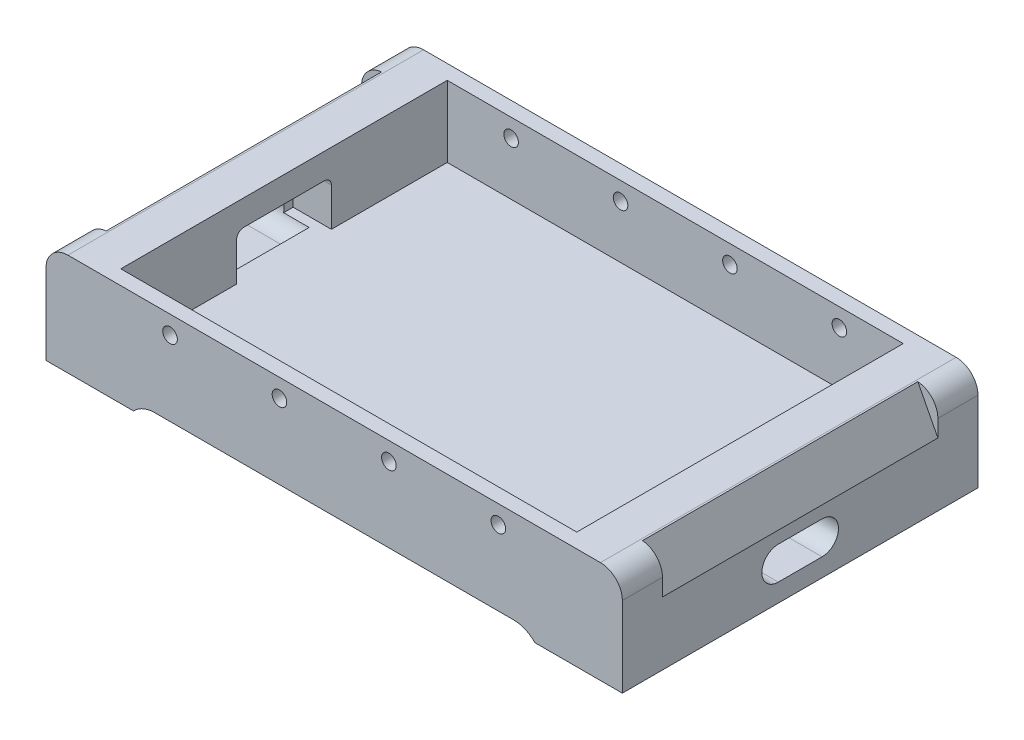
from build123d import *

# Parameters (mm, degrees)
SKETCH1_W            = 501.65
SKETCH1_H            = 88.9
BOSS_EXTRUDE1_DEPTH  = 309.5625
SKETCH2_W            = 349.25
SKETCH2_H            = 7.9375
CUT_EXTRUDE1_DEPTH   = 401.896401245
FILLET1_R            = 25.4
CUT_EXTRUDE2_DEPTH   = 119.85625
FILLET2_R            = 19.05
CUT_EXTRUDE4_DEPTH   = 41.275
SKETCH4_W            = 396.875
SKETCH4_H            = 284.1625
CUT_EXTRUDE3_DEPTH   = 61.9125
SKETCH6_W            = 82.55
SKETCH6_H            = 39.6875
CUT_EXTRUDE5_DEPTH   = 33.3375
FILLET3_R            = 6.35
SKETCH7_R            = 6.35
CUT_EXTRUDE6_DEPTH   = 401.896401245
FILLET3_OF_MIRROR5_R = 6.35


# Some blends are built 0.0001 mm under size
with BuildPart() as part:
    # Sketch1 → Boss-Extrude1 (new body)
    with BuildSketch(Plane.XY):
        Rectangle(SKETCH1_W, SKETCH1_H)
    extrude(amount=BOSS_EXTRUDE1_DEPTH)

    # Sketch2 → Cut-Extrude1 (cut, through all)
    with BuildSketch(Plane.XY.offset(309.5625)):
        with Locations((0, -40.48125)):
            Rectangle(SKETCH2_W, SKETCH2_H)
    extrude(amount=-CUT_EXTRUDE1_DEPTH, mode=Mode.SUBTRACT)

    # Fillet1
    # the kernel refuses this fillet: 25.4 mm, written as the material it adds along each edge
    with BuildSketch(Plane(origin=(174.625, -36.5125, 309.5625), x_dir=(0, -1, 0), z_dir=(0, 0, -1))) as fillet1_piece_1:
        with BuildLine():
            CenterArc((25.4, 18.445083186), FILLET1_R, 180, 46.567463442)
            Line((0, 18.445083186), (-0.508, 18.445083186))
            Line((-0.508, 18.445083186), (-0.508, 0))
            Line((-0.508, 0), (0, -0.508))
            ThreePointArc((0, -0.508), (3.96875, -0.508), (7.58825, -0.368901664))
            Line((7.58825, -0.368901664), (7.9375, 0))
        make_face()
    extrude(amount=309.5625)
    with BuildSketch(Plane(origin=(-174.625, -36.5125, 309.5625), x_dir=(0, -1, 0), z_dir=(0, 0, -1))) as fillet1_piece_2:
        with BuildLine():
            CenterArc((25.4, -18.445083186), FILLET1_R, 133.432536558, 46.567463442)
            Line((0, -18.445083186), (-0.508, -18.445083186))
            Line((-0.508, -18.445083186), (-0.508, 0))
            Line((-0.508, 0), (0, 0.508))
            ThreePointArc((0, 0.508), (3.96875, 0.508), (7.58825, 0.368901664))
            Line((7.58825, 0.368901664), (7.9375, 0))
        make_face()
    extrude(amount=309.5625)

    # Sketch3 → Cut-Extrude2 (cut, symmetric)
    with BuildSketch(Plane.XY.offset(154.78125)):
        Polygon((-250.825, 44.45), (-233.3625, 44.45), (-250.825, 10.5874677), align=None)
    cut_extrude2 = extrude(amount=CUT_EXTRUDE2_DEPTH, both=True, mode=Mode.SUBTRACT)

    # Fillet2
    fillet2_edges = [part.edges().sort_by_distance(p)[0] for p in [
        (250.825, 44.45, 154.78125),
    ]]
    fillet(fillet2_edges, radius=FILLET2_R)
    # the kernel refuses this fillet: 19.05 mm, written as the material it takes off along each edge
    with BuildSketch(Plane(origin=(-250.825, 44.45, -47.625), x_dir=(1, 0, 0), z_dir=(0, 0, 1))) as fillet2_2_piece_1:
        with BuildLine():
            CenterArc((FILLET2_R, -FILLET2_R), FILLET2_R, 90, 90)
            Line((0, -FILLET2_R), (-FILLET2_R * 0.02, -FILLET2_R))
            Line((-FILLET2_R * 0.02, -FILLET2_R), (-FILLET2_R * 0.02, FILLET2_R * 0.02))
            Line((-FILLET2_R * 0.02, FILLET2_R * 0.02), (FILLET2_R, FILLET2_R * 0.02))
            Line((FILLET2_R, FILLET2_R * 0.02), (FILLET2_R, 0))
        make_face()
    extrude(amount=130.175, mode=Mode.SUBTRACT)
    fillet2_3_edges = [part.edges().sort_by_distance(p)[0] for p in [
        (-250.825, 44.45, 292.1),
    ]]
    fillet(fillet2_3_edges, radius=FILLET2_R - 0.0001)  # a hair under: the kernel refuses the full size

    # Sketch5 → Cut-Extrude4 (cut)
    with BuildSketch(Plane.ZY.offset(250.825)):
        with BuildLine():
            Line((135.73125, 0), (173.83125, 0))
            ThreePointArc((173.83125, 0), (188.11875, -14.2875), (173.83125, -28.575))
            Line((173.83125, -28.575), (135.73125, -28.575))
            ThreePointArc((135.73125, -28.575), (121.44375, -14.2875), (135.73125, 0))
        make_face()
    cut_extrude4 = extrude(amount=-CUT_EXTRUDE4_DEPTH, mode=Mode.SUBTRACT)

    # Mirror4: Cut-Extrude2, Cut-Extrude4 across plane
    add(cut_extrude2.mirror(Plane.ZY), mode=Mode.SUBTRACT)
    add(cut_extrude4.mirror(Plane.ZY), mode=Mode.SUBTRACT)

    # Sketch4 → Cut-Extrude3 (cut)
    with BuildSketch(Plane(origin=(0, 44.45, 0), x_dir=(1, 0, 0), z_dir=(0, 1, 0))):
        with Locations((0, -154.78125)):
            Rectangle(SKETCH4_W, SKETCH4_H)
    extrude(amount=-CUT_EXTRUDE3_DEPTH, mode=Mode.SUBTRACT)

    # Sketch6 → Cut-Extrude5 (cut)
    with BuildSketch(Plane.ZY.offset(198.4375)):
        with Locations((154.78125, 2.38125)):
            Rectangle(SKETCH6_W, SKETCH6_H)
    cut_extrude5 = extrude(amount=CUT_EXTRUDE5_DEPTH, mode=Mode.SUBTRACT)

    # Fillet3
    fillet3_edges = [part.edges().sort_by_distance(p)[0] for p in [
        (-215.10625, 22.225, 196.05625),
        (-215.10625, 22.225, 113.50625),
    ]]
    fillet(fillet3_edges, radius=FILLET3_R)

    # Sketch7 → Cut-Extrude6 (cut, through all)
    with BuildSketch(Plane.XY.offset(309.5625)):
        with Locations((-47.625, 28.575)):
            Circle(SKETCH7_R)
        with Locations((-142.875, 28.575)):
            Circle(SKETCH7_R)
    cut_extrude6 = extrude(amount=-CUT_EXTRUDE6_DEPTH, mode=Mode.SUBTRACT)

    # Mirror5: Cut-Extrude5, Cut-Extrude6 across plane
    add(cut_extrude5.mirror(Plane.ZY), mode=Mode.SUBTRACT)
    add(cut_extrude6.mirror(Plane.ZY), mode=Mode.SUBTRACT)

    # Fillet3 of Mirror5
    fillet3_of_mirror5_edges = [part.edges().sort_by_distance(p)[0] for p in [
        (215.10625, 22.225, 196.05625),
        (215.10625, 22.225, 113.50625),
    ]]
    fillet(fillet3_of_mirror5_edges, radius=FILLET3_OF_MIRROR5_R)


solid = part.part
